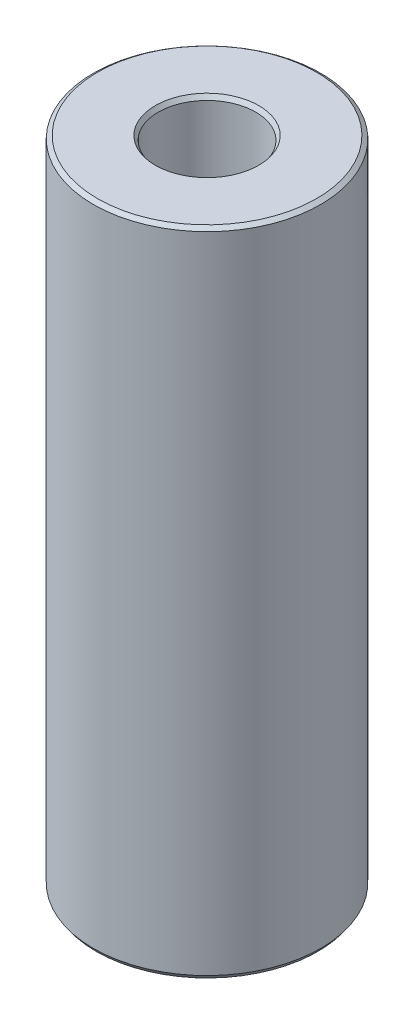
from build123d import *
from OCP.BRepFilletAPI import BRepFilletAPI_MakeChamfer

# Parameters (mm, degrees)
SKETCH1_R           = 40
BOSS_EXTRUDE1_DEPTH = 229.12174493
SKETCH2_R           = 17.157204472
CUT_EXTRUDE1_DEPTH  = 237.001639824
CHAMFER1_SIZE       = 1.044332572
CHAMFER1_SIZE2      = 1.47722546


with BuildPart() as part:
    # Sketch1 → Boss-Extrude1 (new body)
    with BuildSketch(Plane(origin=(0, 0, 0), x_dir=(1, 0, 0), z_dir=(0, 1, 0))):
        Circle(SKETCH1_R)
    extrude(amount=BOSS_EXTRUDE1_DEPTH)

    # Sketch2 → Cut-Extrude1 (cut, through all)
    with BuildSketch(Plane(origin=(0, 0, 0), x_dir=(1, 0, 0), z_dir=(0, 1, 0))):
        Circle(SKETCH2_R)
    extrude(amount=CUT_EXTRUDE1_DEPTH, mode=Mode.SUBTRACT)

    # Chamfer1: one chamfer whose edges measure the first distance from different faces: ONE call of the kernel's chamfer builder (chamfer() names one face for all edges)
    chamfer1_edges_1 = [part.edges().sort_by_distance(p)[0] for p in [
        (-17.157204472, 229.12174493, 0),
    ]]
    chamfer1_side_1 = [part.faces().sort_by_distance(p)[0] for p in [
        (-38.86862915, 229.12174493, 0),
    ]]
    chamfer1_edges_2 = [part.edges().sort_by_distance(p)[0] for p in [
        (-17.157204472, 0, 0),
    ]]
    chamfer1_side_2 = [part.faces().sort_by_distance(p)[0] for p in [
        (-17.157204472, 114.560872465, 0),
    ]]
    chamfer1_edges_3 = [part.edges().sort_by_distance(p)[0] for p in [
        (-40, 0, 0),
    ]]
    chamfer1_side_3 = [part.faces().sort_by_distance(p)[0] for p in [
        (-38.86862915, 0, 0),
    ]]
    chamfer1_edges_4 = [part.edges().sort_by_distance(p)[0] for p in [
        (-40, 229.12174493, 0),
    ]]
    chamfer1_side_4 = [part.faces().sort_by_distance(p)[0] for p in [
        (-40, 114.560872465, 0),
    ]]
    chamfer1 = BRepFilletAPI_MakeChamfer(part.part.solid().wrapped)
    for e in chamfer1_edges_1:
        chamfer1.Add(CHAMFER1_SIZE, CHAMFER1_SIZE2, e.wrapped, chamfer1_side_1[0].wrapped)  # the first distance lies on this face
    for e in chamfer1_edges_2:
        chamfer1.Add(CHAMFER1_SIZE, CHAMFER1_SIZE2, e.wrapped, chamfer1_side_2[0].wrapped)  # the first distance lies on this face
    for e in chamfer1_edges_3:
        chamfer1.Add(CHAMFER1_SIZE, CHAMFER1_SIZE2, e.wrapped, chamfer1_side_3[0].wrapped)  # the first distance lies on this face
    for e in chamfer1_edges_4:
        chamfer1.Add(CHAMFER1_SIZE, CHAMFER1_SIZE2, e.wrapped, chamfer1_side_4[0].wrapped)  # the first distance lies on this face
    add(Compound.cast(chamfer1.Shape()), mode=Mode.REPLACE)


solid = part.part
